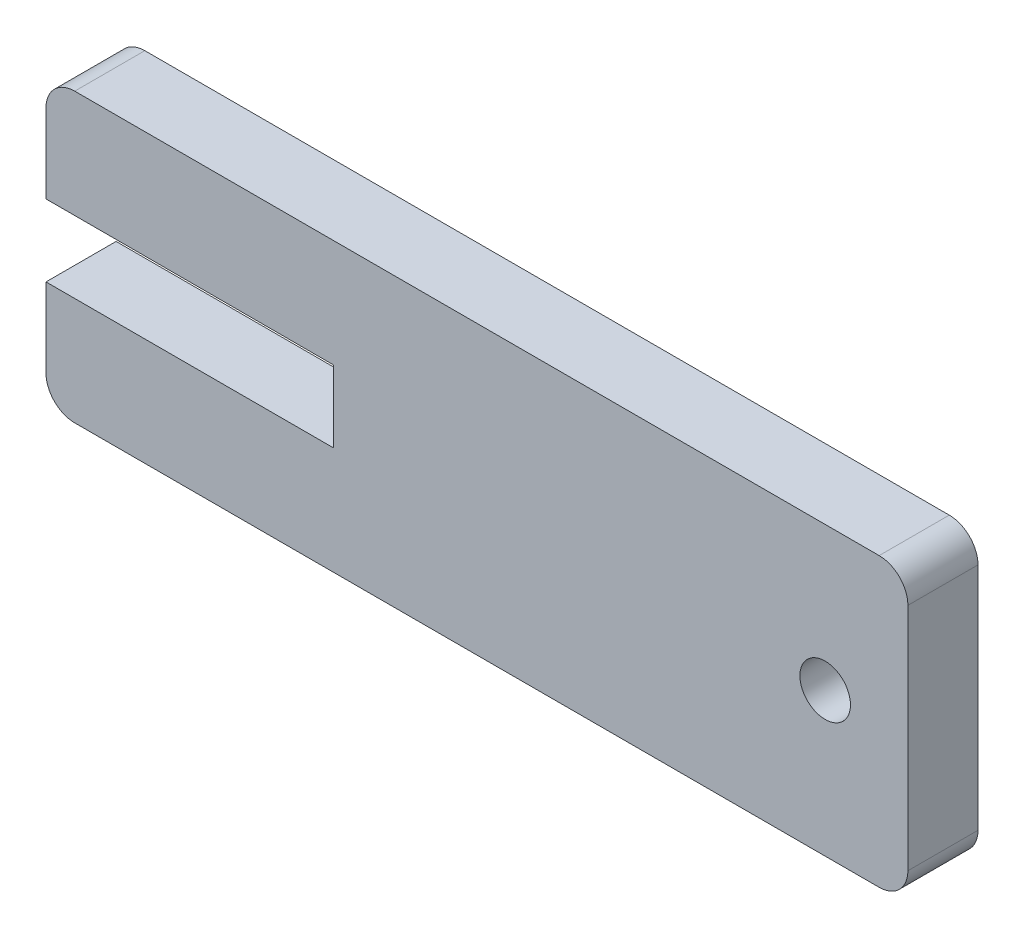
from build123d import *

# Parameters (mm, degrees)
BOSS_EXTRUDE1_DEPTH = 1.5494
FILLET1_R           = 1.27
SKETCH2_R           = 1.1176
CUT_EXTRUDE1_DEPTH  = 27.364465886


with BuildPart() as part:
    # Sketch1 → Boss-Extrude1 (new, symmetric)
    with BuildSketch(Plane.XY):
        Polygon((-12.7, 1.5875), (-12.7, 6.35), (25.4, 6.35), (25.4, -6.35), (-12.7, -6.35), (-12.7, -1.5875), (0, -1.5875), (0, 1.5875), align=None)
    extrude(amount=BOSS_EXTRUDE1_DEPTH, both=True)

    # Fillet1
    fillet1_edges = [part.edges().sort_by_distance(p)[0] for p in [
        (-12.7, -6.35, 0),
        (25.4, -6.35, 0),
        (25.4, 6.35, 0),
        (-12.7, 6.35, 0),
    ]]
    fillet(fillet1_edges, radius=FILLET1_R)

    # Sketch2 → Cut-Extrude1 (cut, through all)
    with BuildSketch(Plane.XY.offset(1.5494)):
        with Locations((21.7424, 0)):
            Circle(SKETCH2_R)
    extrude(amount=-CUT_EXTRUDE1_DEPTH, mode=Mode.SUBTRACT)


solid = part.part
